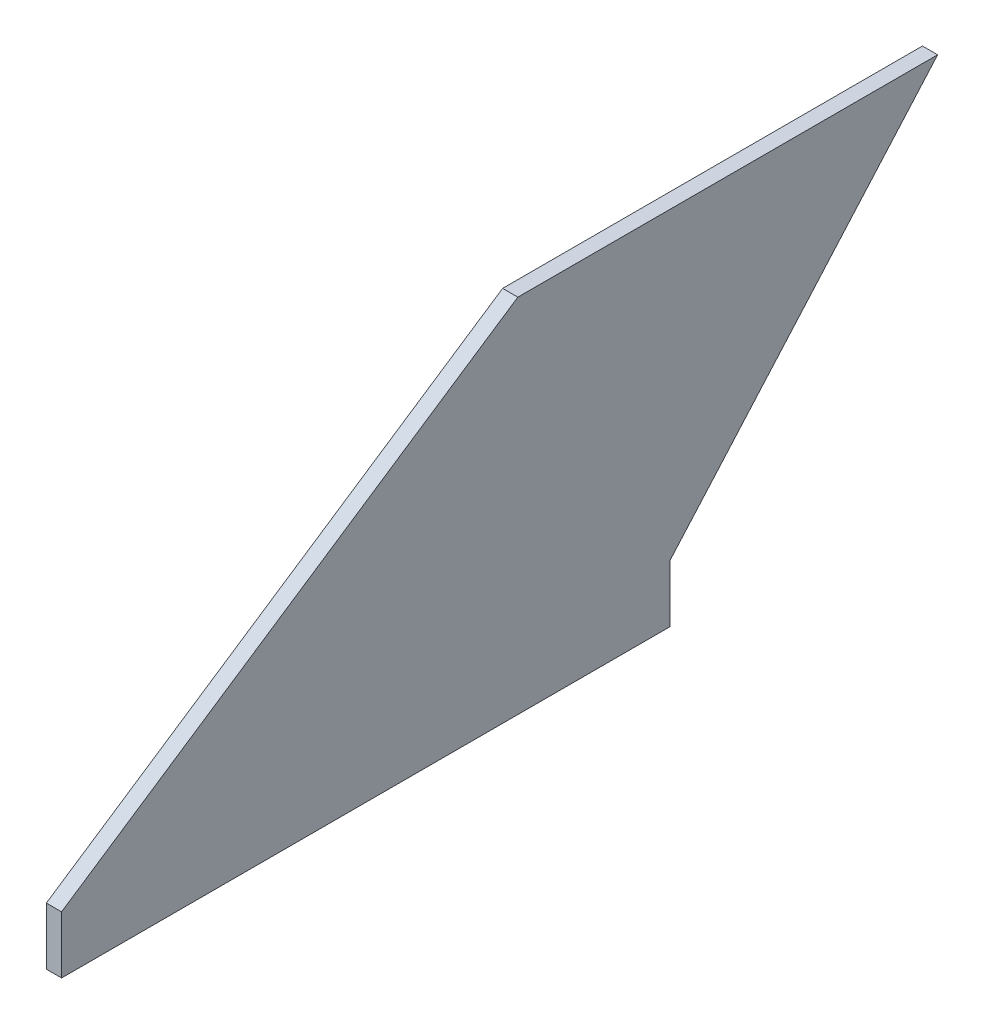
from build123d import *

# Parameters (mm, degrees)
BOSS_EXTRUDE1_DEPTH = 3.175


with BuildPart() as part:
    # Sketch2 → Boss-Extrude1 (new body)
    with BuildSketch(Plane(origin=(0, 0, 0), x_dir=(0, 0, -1), z_dir=(1, 0, 0))):
        Polygon((0, 0), (95.25, 63.5), (182.88, 63.5), (127, 0), (127, -11.9634), (0, -11.9634), align=None)
    extrude(amount=BOSS_EXTRUDE1_DEPTH)


solid = part.part
